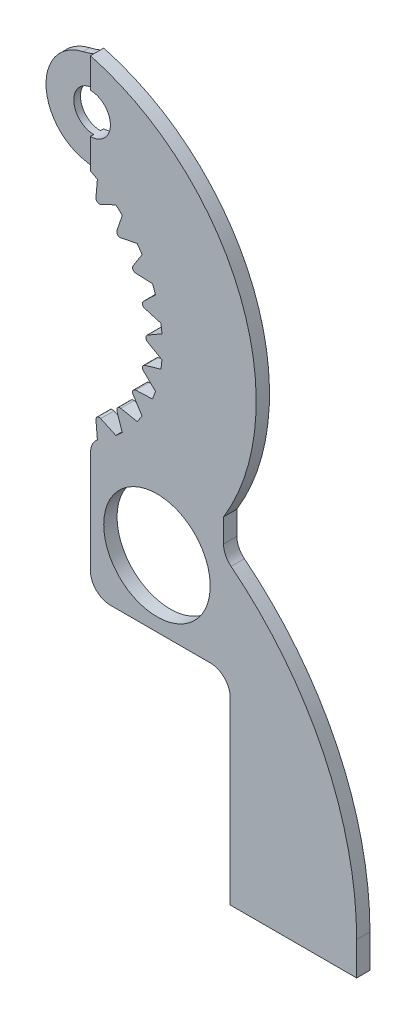
from build123d import *

# Parameters (mm, degrees)
BOSS_EXTRUDE1_DEPTH       = 2
BOSS_EXTRUDE2_DEPTH       = 2
CIRPATTERN1_COUNT         = 5
CIRPATTERN1_ANGLE         = 55
CIRPATTERN2_COPY_1_DEPTH  = 2
CIRPATTERN2_COPY_2_DEPTH  = 2
CIRPATTERN2_COPY_3_DEPTH  = 2
CIRPATTERN2_COPY_4_DEPTH  = 2
CIRPATTERN2_COPY_5_DEPTH  = 2
CIRPATTERN2_COPY_6_DEPTH  = 2
CIRPATTERN2_COPY_7_DEPTH  = 2
CIRPATTERN2_COPY_8_DEPTH  = 2
CIRPATTERN2_COPY_9_DEPTH  = 2
CIRPATTERN2_COPY_10_DEPTH = 2
CIRPATTERN2_COPY_11_DEPTH = 2
CIRPATTERN2_COPY_12_DEPTH = 2
CIRPATTERN2_COPY_13_DEPTH = 2
CIRPATTERN2_COPY_14_DEPTH = 2
CIRPATTERN2_COPY_15_DEPTH = 2
CIRPATTERN2_COPY_16_DEPTH = 2
CIRPATTERN2_COPY_17_DEPTH = 2
CIRPATTERN2_COPY_18_DEPTH = 2
CIRPATTERN2_COPY_19_DEPTH = 2
CIRPATTERN2_COPY_20_DEPTH = 2
SKETCH3_R                 = 8
CUT_EXTRUDE1_DEPTH        = 54.888774341
BOSS_EXTRUDE3_DEPTH       = 0.5
BOSS_EXTRUDE3_DEPTH_BACK  = 0.5
SKETCH4_R                 = 7.170254919
CUT_EXTRUDE2_DEPTH        = 57.914170049
CUT_EXTRUDE2_DEPTH_BACK   = 57.914170049
SKETCH5_R                 = 3
FILLET1_R                 = 50
FILLET2_R                 = 10
FILLET3_R                 = 3
FILLET4_R                 = 0.5


with BuildPart() as part:
    # Sketch1 → Boss-Extrude1 (new body)
    with BuildSketch(Plane.XY):
        with BuildLine():
            Line((-20, -5), (-20, -20))
            Line((-20, -20), (0, -20))
            Line((0, -20), (1, -20))
            Line((1, -20), (1, -50))
            Line((1, -50), (20, -50))
            Line((20, -50), (20, -5))
            Line((20, -5), (0, -5))
            Line((0, -5), (0, 0))
            ThreePointArc((0, 0), (2.5, 30), (-20, 50))
            Line((-20, 50), (-20, 35))
            ThreePointArc((-20, 35), (-9.184405197, 17.5), (-20, 0))
            Line((-20, 0), (-20, -5))
        make_face()
    extrude(amount=BOSS_EXTRUDE1_DEPTH)

    # Sketch2 → Boss-Extrude2 (add)
    with BuildSketch(Plane.XY.offset(2)):
        Polygon((-12.184405197, 17.5), (-8.511312338, 19.620661151), (-8.511312338, 15.379338849), align=None)
    boss_extrude2 = extrude(amount=-BOSS_EXTRUDE2_DEPTH)

    # CirPattern1: Boss-Extrude2 ×5 about axis
    cirpattern1_axis = Axis((-28.75, 17.5, 0), (0, 0, -1))
    for i in range(1, CIRPATTERN1_COUNT):
        add(boss_extrude2.rotate(cirpattern1_axis, i * CIRPATTERN1_ANGLE / (CIRPATTERN1_COUNT - 1)))

    # CirPattern2 copy 1 sketch → CirPattern2 copy 1 (add)
    with BuildSketch(Plane.XY.offset(2)):
        Polygon((-12.184405197, 17.5), (-8.511312338, 19.620661151), (-8.511312338, 15.379338849), align=None)
    extrude(amount=-CIRPATTERN2_COPY_1_DEPTH)

    # CirPattern2 copy 2 sketch → CirPattern2 copy 2 (add)
    with BuildSketch(Plane(origin=(3.335587623, 7.334983183, 2), x_dir=(0.9713420698132613, 0.23768589232617357, 0), z_dir=(0, 0, 1))):
        Polygon((-12.184405197, 17.5), (-8.511312338, 19.620661151), (-8.511312338, 15.379338849), align=None)
    extrude(amount=-CIRPATTERN2_COPY_2_DEPTH)

    # CirPattern2 copy 3 sketch → CirPattern2 copy 3 (add)
    with BuildSketch(Plane(origin=(4.832162185, 15.25258305, 2), x_dir=(0.8870108331782213, 0.46174861323503485, 0), z_dir=(0, 0, 1))):
        Polygon((-12.184405197, 17.5), (-8.511312338, 19.620661151), (-8.511312338, 15.379338849), align=None)
    extrude(amount=-CIRPATTERN2_COPY_3_DEPTH)

    # CirPattern2 copy 4 sketch → CirPattern2 copy 4 (add)
    with BuildSketch(Plane(origin=(4.403946229, 23.298995553, 2), x_dir=(0.7518398074789764, 0.6593458151000701, 0), z_dir=(0, 0, 1))):
        Polygon((-12.184405197, 17.5), (-8.511312338, 19.620661151), (-8.511312338, 15.379338849), align=None)
    extrude(amount=-CIRPATTERN2_COPY_4_DEPTH)

    # CirPattern2 copy 5 sketch → CirPattern2 copy 5 (add)
    with BuildSketch(Plane(origin=(-4.983418609, -6.331955626, 2), x_dir=(0.9713420698132613, -0.23768589232617357, 0), z_dir=(0, 0, 1))):
        Polygon((-12.184405197, 17.5), (-8.511312338, 19.620661151), (-8.511312338, 15.379338849), align=None)
    extrude(amount=-CIRPATTERN2_COPY_5_DEPTH)

    # CirPattern2 copy 6 sketch → CirPattern2 copy 6 (add)
    with BuildSketch(Plane.XY.offset(2)):
        Polygon((-12.184405197, 17.5), (-8.511312338, 19.620661151), (-8.511312338, 15.379338849), align=None)
    extrude(amount=-CIRPATTERN2_COPY_6_DEPTH)

    # CirPattern2 copy 7 sketch → CirPattern2 copy 7 (add)
    with BuildSketch(Plane(origin=(3.335587623, 7.334983183, 2), x_dir=(0.9713420698132613, 0.2376858923261736, 0), z_dir=(0, 0, 1))):
        Polygon((-12.184405197, 17.5), (-8.511312338, 19.620661151), (-8.511312338, 15.379338849), align=None)
    extrude(amount=-CIRPATTERN2_COPY_7_DEPTH)

    # CirPattern2 copy 8 sketch → CirPattern2 copy 8 (add)
    with BuildSketch(Plane(origin=(4.832162185, 15.25258305, 2), x_dir=(0.8870108331782214, 0.4617486132350349, 0), z_dir=(0, 0, 1))):
        Polygon((-12.184405197, 17.5), (-8.511312338, 19.620661151), (-8.511312338, 15.379338849), align=None)
    extrude(amount=-CIRPATTERN2_COPY_8_DEPTH)

    # CirPattern2 copy 9 sketch → CirPattern2 copy 9 (add)
    with BuildSketch(Plane(origin=(-11.329039278, -11.297962211, 2), x_dir=(0.8870108331782213, -0.46174861323503485, 0), z_dir=(0, 0, 1))):
        Polygon((-12.184405197, 17.5), (-8.511312338, 19.620661151), (-8.511312338, 15.379338849), align=None)
    extrude(amount=-CIRPATTERN2_COPY_9_DEPTH)

    # CirPattern2 copy 10 sketch → CirPattern2 copy 10 (add)
    with BuildSketch(Plane(origin=(-4.983418609, -6.331955626, 2), x_dir=(0.9713420698132613, -0.2376858923261736, 0), z_dir=(0, 0, 1))):
        Polygon((-12.184405197, 17.5), (-8.511312338, 19.620661151), (-8.511312338, 15.379338849), align=None)
    extrude(amount=-CIRPATTERN2_COPY_10_DEPTH)

    # CirPattern2 copy 11 sketch → CirPattern2 copy 11 (add)
    with BuildSketch(Plane.XY.offset(2)):
        Polygon((-12.184405197, 17.5), (-8.511312338, 19.620661151), (-8.511312338, 15.379338849), align=None)
    extrude(amount=-CIRPATTERN2_COPY_11_DEPTH)

    # CirPattern2 copy 12 sketch → CirPattern2 copy 12 (add)
    with BuildSketch(Plane(origin=(3.335587623, 7.334983183, 2), x_dir=(0.9713420698132613, 0.2376858923261736, 0), z_dir=(0, 0, 1))):
        Polygon((-12.184405197, 17.5), (-8.511312338, 19.620661151), (-8.511312338, 15.379338849), align=None)
    extrude(amount=-CIRPATTERN2_COPY_12_DEPTH)

    # CirPattern2 copy 13 sketch → CirPattern2 copy 13 (add)
    with BuildSketch(Plane(origin=(-18.673157299, -14.613388815, 2), x_dir=(0.7518398074789764, -0.6593458151000701, 0), z_dir=(0, 0, 1))):
        Polygon((-12.184405197, 17.5), (-8.511312338, 19.620661151), (-8.511312338, 15.379338849), align=None)
    extrude(amount=-CIRPATTERN2_COPY_13_DEPTH)

    # CirPattern2 copy 14 sketch → CirPattern2 copy 14 (add)
    with BuildSketch(Plane(origin=(-11.329039278, -11.297962211, 2), x_dir=(0.8870108331782214, -0.4617486132350349, 0), z_dir=(0, 0, 1))):
        Polygon((-12.184405197, 17.5), (-8.511312338, 19.620661151), (-8.511312338, 15.379338849), align=None)
    extrude(amount=-CIRPATTERN2_COPY_14_DEPTH)

    # CirPattern2 copy 15 sketch → CirPattern2 copy 15 (add)
    with BuildSketch(Plane(origin=(-4.983418609, -6.331955626, 2), x_dir=(0.9713420698132613, -0.2376858923261736, 0), z_dir=(0, 0, 1))):
        Polygon((-12.184405197, 17.5), (-8.511312338, 19.620661151), (-8.511312338, 15.379338849), align=None)
    extrude(amount=-CIRPATTERN2_COPY_15_DEPTH)

    # CirPattern2 copy 16 sketch → CirPattern2 copy 16 (add)
    with BuildSketch(Plane.XY.offset(2)):
        Polygon((-12.184405197, 17.5), (-8.511312338, 19.620661151), (-8.511312338, 15.379338849), align=None)
    extrude(amount=-CIRPATTERN2_COPY_16_DEPTH)

    # CirPattern2 copy 17 sketch → CirPattern2 copy 17 (add)
    with BuildSketch(Plane(origin=(3.335587623, 7.334983183, 2), x_dir=(0.9713420698132613, 0.2376858923261736, 0), z_dir=(0, 0, 1))):
        Polygon((-12.184405197, 17.5), (-8.511312338, 19.620661151), (-8.511312338, 15.379338849), align=None)
    extrude(amount=-CIRPATTERN2_COPY_17_DEPTH)

    # CirPattern2 copy 18 sketch → CirPattern2 copy 18 (add)
    with BuildSketch(Plane(origin=(4.832162185, 15.25258305, 2), x_dir=(0.8870108331782213, 0.46174861323503485, 0), z_dir=(0, 0, 1))):
        Polygon((-12.184405197, 17.5), (-8.511312338, 19.620661151), (-8.511312338, 15.379338849), align=None)
    extrude(amount=-CIRPATTERN2_COPY_18_DEPTH)

    # CirPattern2 copy 19 sketch → CirPattern2 copy 19 (add)
    with BuildSketch(Plane(origin=(4.403946229, 23.298995553, 2), x_dir=(0.7518398074789764, 0.6593458151000701, 0), z_dir=(0, 0, 1))):
        Polygon((-12.184405197, 17.5), (-8.511312338, 19.620661151), (-8.511312338, 15.379338849), align=None)
    extrude(amount=-CIRPATTERN2_COPY_19_DEPTH)

    # CirPattern2 copy 20 sketch → CirPattern2 copy 20 (add)
    with BuildSketch(Plane(origin=(2.07548332, 31.013033637, 2), x_dir=(0.5735764363510444, 0.819152044288993, 0), z_dir=(0, 0, 1))):
        Polygon((-12.184405197, 17.5), (-8.511312338, 19.620661151), (-8.511312338, 15.379338849), align=None)
    extrude(amount=-CIRPATTERN2_COPY_20_DEPTH)

    # Sketch3 → Cut-Extrude1 (cut, through all)
    with BuildSketch(Plane(origin=(0, 0, 0), x_dir=(-1, 0, 0), z_dir=(0, 0, -1))):
        with Locations((10, -10)):
            Circle(SKETCH3_R)
    extrude(amount=-CUT_EXTRUDE1_DEPTH, mode=Mode.SUBTRACT)

    # Sketch4 → Boss-Extrude3 (add, two sides: drawn at the far end of the back side and taken through both)
    with BuildSketch(Plane.XY.offset(1).offset(-BOSS_EXTRUDE3_DEPTH_BACK)):
        with Locations((-20, 42.5)):
            Circle(SKETCH4_R)
    extrude(amount=BOSS_EXTRUDE3_DEPTH + BOSS_EXTRUDE3_DEPTH_BACK)

    # Sketch5 → Cut-Extrude2 (cut, two sides: drawn at the far end of the back side and taken through both)
    with BuildSketch(Plane.XY.offset(1).offset(-CUT_EXTRUDE2_DEPTH_BACK)):
        with Locations(Location((-20, 42.5, 0), (0, 0, 90))):
            Circle(SKETCH5_R)
    extrude(amount=CUT_EXTRUDE2_DEPTH + CUT_EXTRUDE2_DEPTH_BACK, mode=Mode.SUBTRACT)

    # Fillet1
    # the kernel refuses this fillet: 50 mm, written as the material it takes off along each edge
    with BuildSketch(Plane(origin=(20, -5, -100), x_dir=(-1, 0, 0), z_dir=(0, 0, 1))) as fillet1_piece_1:
        with BuildLine():
            CenterArc((50, 40), FILLET1_R, 180, 53.130102354)
            Line((0, 40), (-1, 40))
            Line((-1, 40), (-1, 0))
            Line((-1, 0), (0, -1))
            ThreePointArc((0, -1), (10, -1), (19.4, -0.8))
            Line((19.4, -0.8), (20, 0))
        make_face()
    extrude(amount=202, mode=Mode.SUBTRACT)

    # Fillet2
    # the kernel refuses this fillet: 10 mm, written as the material it adds along each edge
    with BuildSketch(Plane(origin=(-20, 49.670254919, 0.5), x_dir=(0, 1, 0), z_dir=(0, 0, 1))) as fillet2_piece_1:
        with BuildLine():
            CenterArc((9.56758868, 3.829131186), FILLET2_R, 192.885861341, 9.62838373)
            Line((-0.180573871, 1.599035475), (-0.375537122, 1.55443356))
            ThreePointArc((-0.375537122, 1.55443356), (-0.244023303, 0.78215679), (-0.2, 0))
            Line((-0.2, 0), (0, -0.2))
            ThreePointArc((0, -0.2), (0.16487254, -0.2), (0.144988209, -0.076582624))
            Line((0.144988209, -0.076582624), (0.329745081, 0))
        make_face()
    extrude(amount=1)

    # Fillet3
    # the kernel refuses this fillet: 3 mm, written as the material it adds along each edge
    with BuildSketch(Plane(origin=(0, -5, 0), x_dir=(0.7913345913846653, -0.6113833204120512, 0), z_dir=(0, 0, 1))) as fillet3_piece_1:
        with BuildLine():
            CenterArc((1.473507854, 2.999692996), FILLET3_R, 217.689593385, 51.490710876)
            Line((-0.90049592, 1.165543035), (-0.947975995, 1.128860036))
            Line((-0.947975995, 1.128860036), (-0.047480075, -0.036682999))
            Line((-0.047480075, -0.036682999), (0.000858354, -0.05999386))
            ThreePointArc((0.000858354, -0.05999386), (0.715295075, -0.054883268), (1.429731796, -0.05999386))
            Line((1.429731796, -0.05999386), (1.43059015, 0))
        make_face()
    extrude(amount=2)
    with BuildSketch(Plane(origin=(1, -20, 0), x_dir=(-1, 0, 0), z_dir=(0, 0, 1))) as fillet3_piece_2:
        with BuildLine():
            CenterArc((FILLET3_R, FILLET3_R), FILLET3_R, 180, 90)
            Line((0, FILLET3_R), (-FILLET3_R * 0.02, FILLET3_R))
            Line((-FILLET3_R * 0.02, FILLET3_R), (-FILLET3_R * 0.02, -FILLET3_R * 0.02))
            Line((-FILLET3_R * 0.02, -FILLET3_R * 0.02), (FILLET3_R, -FILLET3_R * 0.02))
            Line((FILLET3_R, -FILLET3_R * 0.02), (FILLET3_R, 0))
        make_face()
    extrude(amount=2)
    with BuildSketch(Plane(origin=(-20, 35.329745081, 1.5), x_dir=(0, -1, 0), z_dir=(0, 0, -1))) as fillet3_piece_3:
        with BuildLine():
            CenterArc((2.875350756, 1.587416691), FILLET3_R, 188.979685055, 22.967606948)
            Line((-0.087880477, 1.119163917), (-0.147145102, 1.109798862))
            ThreePointArc((-0.147145102, 1.109798862), (-0.081819755, 0.556607533), (-0.06, 0))
            Line((-0.06, 0), (0, -0.06))
            ThreePointArc((0, -0.06), (0.16487254, -0.06), (0.278832967, -0.031748334))
            Line((0.278832967, -0.031748334), (0.329745081, 0))
        make_face()
    extrude(amount=1)
    # the kernel refuses this fillet: 3 mm, written as the material it takes off along each edge
    with BuildSketch(Plane(origin=(-20, -20, -7.5), x_dir=(1, 0, 0), z_dir=(0, 0, 1))) as fillet3_2_piece_1:
        with BuildLine():
            CenterArc((FILLET3_R, FILLET3_R), FILLET3_R, 180, 90)
            Line((0, FILLET3_R), (-FILLET3_R * 0.02, FILLET3_R))
            Line((-FILLET3_R * 0.02, FILLET3_R), (-FILLET3_R * 0.02, -FILLET3_R * 0.02))
            Line((-FILLET3_R * 0.02, -FILLET3_R * 0.02), (FILLET3_R, -FILLET3_R * 0.02))
            Line((FILLET3_R, -FILLET3_R * 0.02), (FILLET3_R, 0))
        make_face()
    extrude(amount=17, mode=Mode.SUBTRACT)
    with BuildSketch(Plane(origin=(-20, 0, -4.282755208), x_dir=(0.8804344923841002, 0.47416780217592974, 0), z_dir=(0, 0, 1))) as fillet3_2_piece_2:
        with BuildLine():
            CenterArc((1.829005627, -2.93077757), FILLET3_R, 102.332157439, 49.362663028)
            Line((-0.81229785, -1.508274163), (-0.865123919, -1.479824095))
            Line((-0.865123919, -1.479824095), (-0.05282607, 0.028450068))
            Line((-0.05282607, 0.028450068), (0.001821978, 0.05997233))
            ThreePointArc((0.001821978, 0.05997233), (0.59413473, 0.050977083), (1.175454736, 0.058615551))
            Line((1.175454736, 0.058615551), (1.188269459, 0))
        make_face()
    extrude(amount=10.565510417, mode=Mode.SUBTRACT)

    # Fillet4
    fillet4_edges = [part.edges().sort_by_distance(p)[0] for p in [
        (-19.248365167, 3.930259152, 1),
        (-12.659140856, 21.437408183, 1),
        (-14.056137952, 25.149140428, 1),
        (-16.295326392, 28.422455608, 1),
        (-19.248365167, 31.069740848, 1),
        (-12.184405197, 17.5, 1),
        (-12.659140856, 13.562591817, 1),
        (-14.056137952, 9.850859572, 1),
        (-16.295326392, 6.577544392, 1),
    ]]
    fillet(fillet4_edges, radius=FILLET4_R)


solid = part.part
